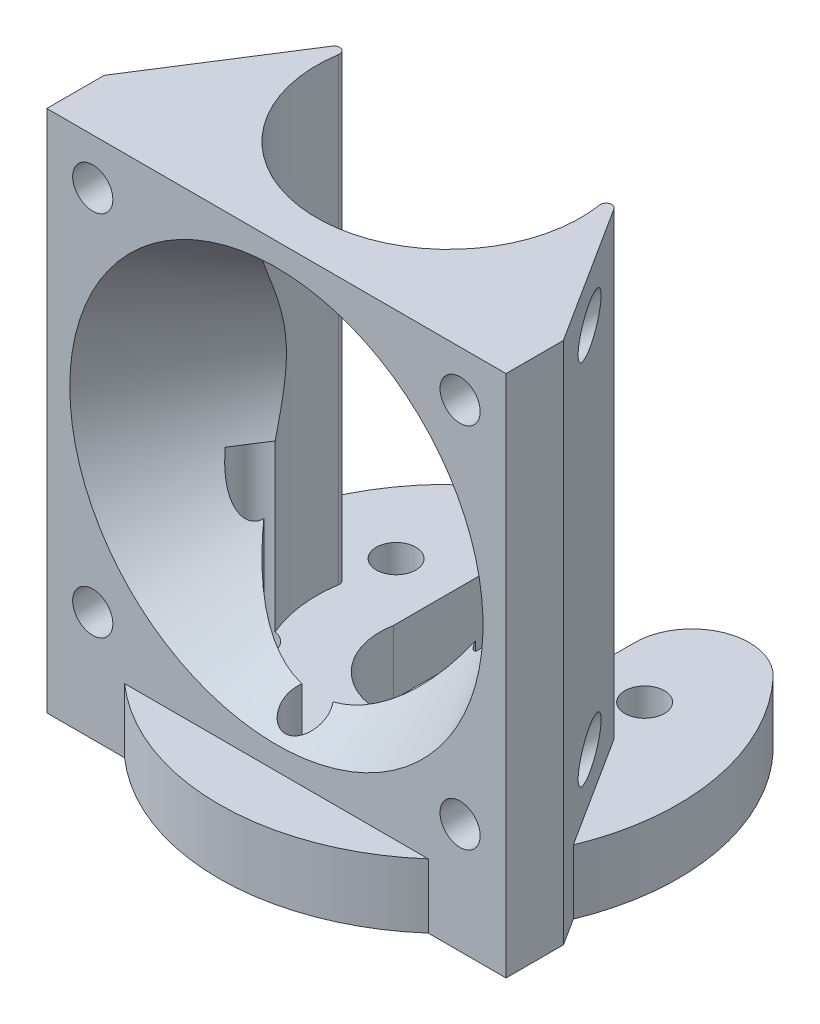
from build123d import *

# Parameters (mm, degrees)
SKETCH1_R           = 20
SKETCH1_R_2         = 6
BOSS_EXTRUDE1_DEPTH = 5.6
CUT_EXTRUDE1_DEPTH  = 29.833314066
FILLET1_R           = 5
BOSS_EXTRUDE2_DEPTH = 40
BOSS_EXTRUDE3_REACH = 55.66
FILLET2_R           = 0.5
SKETCH6_R           = 1.75
CUT_EXTRUDE2_DEPTH  = 59.290171969
SKETCH7_R           = 1.725
CUT_EXTRUDE4_DEPTH  = 20


with BuildPart() as part:
    # Sketch1 → Boss-Extrude1 (new body)
    with BuildSketch(Plane(origin=(0, 0, 0), x_dir=(1, 0, 0), z_dir=(0, 1, 0))):
        Circle(SKETCH1_R)
        Circle(SKETCH1_R_2, mode=Mode.SUBTRACT)
    extrude(amount=BOSS_EXTRUDE1_DEPTH)

    # Sketch2 → Cut-Extrude1 (cut, through all)
    with BuildSketch(Plane(origin=(0, 5.6, 0), x_dir=(1, 0, 0), z_dir=(0, 1, 0))):
        with BuildLine():
            Line((-5.9, 1.090871211), (-5.9, 19.109945055))
            ThreePointArc((-5.9, 19.109945055), (0, 20), (5.9, 19.109945055))
            Line((5.9, 19.109945055), (5.9, 1.090871211))
            ThreePointArc((5.9, 1.090871211), (0, 6), (-5.9, 1.090871211))
        make_face()
    extrude(amount=-CUT_EXTRUDE1_DEPTH, mode=Mode.SUBTRACT)

    # Fillet1
    fillet1_edges = [part.edges().sort_by_distance(p)[0] for p in [
        (5.9, 2.8, -19.109945055),
        (-5.9, 2.8, -19.109945055),
    ]]
    fillet(fillet1_edges, radius=FILLET1_R)

    # Sketch3 → Boss-Extrude2 (add)
    with BuildSketch(Plane(origin=(0, 5.6, 0), x_dir=(1, 0, 0), z_dir=(0, 1, 0))):
        with BuildLine():
            Line((-20, -15), (20, -15))
            Line((20, -15), (20, -10))
            Line((20, -10), (9.700666049, 6.176332099))
            ThreePointArc((9.700666049, 6.176332099), (0, -11.5), (-9.700666049, 6.176332099))
            Line((-9.700666049, 6.176332099), (-20, -10))
            Line((-20, -10), (-20, -15))
        make_face()
    extrude(amount=BOSS_EXTRUDE2_DEPTH)

    # Sketch4 → Boss-Extrude3 (add, up to next)
    with BuildSketch(Plane.XZ, mode=Mode.PRIVATE) as boss_extrude3_sk1:
        with BuildLine():
            Line((13.228756555, 15), (20, 15))
            Line((20, 15), (20, 10))
            Line((20, 10), (18.488817631, 7.626507891))
            ThreePointArc((18.488817631, 7.626507891), (16.281683713, 11.6149376), (13.228756555, 15))
        make_face()
    boss_extrude3_tool1 = extrude(boss_extrude3_sk1.sketch, amount=-BOSS_EXTRUDE3_REACH, mode=Mode.PRIVATE) - part.part
    # Sketch4 → Boss-Extrude3 (add, up to next)
    with BuildSketch(Plane.XZ, mode=Mode.PRIVATE) as boss_extrude3_sk2:
        with BuildLine():
            Line((-20, 10), (-18.488817631, 7.626507891))
            ThreePointArc((-18.488817631, 7.626507891), (-16.281683713, 11.6149376), (-13.228756555, 15))
            Line((-13.228756555, 15), (-20, 15))
            Line((-20, 15), (-20, 10))
        make_face()
    boss_extrude3_tool2 = extrude(boss_extrude3_sk2.sketch, amount=-BOSS_EXTRUDE3_REACH, mode=Mode.PRIVATE) - part.part
    add(boss_extrude3_tool1.solids().sort_by_distance((17.721122, 0, 12.432326))[0])
    add(boss_extrude3_tool2.solids().sort_by_distance((-17.721122, 0, 12.432326))[0])

    # Fillet2
    fillet2_edges = [part.edges().sort_by_distance(p)[0] for p in [
        (-9.700666049, 25.6, -6.176332099),
    ]]
    fillet(fillet2_edges, radius=FILLET2_R)
    fillet2_2_edges = [part.edges().sort_by_distance(p)[0] for p in [
        (9.700666049, 25.6, -6.176332099),
    ]]
    fillet(fillet2_2_edges, radius=FILLET2_R)

    # Sketch5 → Cut-Revolve1 (revolve, cut)
    with BuildSketch(Plane(origin=(0, 25.6, 0), x_dir=(1, 0, 0), z_dir=(0, 1, 0))):
        Polygon((0, -15), (18, -15), (11.092194302, -3.035329563), (0, -3.035329563), align=None)
    revolve(axis=Axis((0, 25.6, 0), (0, 0, 1)), mode=Mode.SUBTRACT)

    # Sketch6 → Cut-Extrude2 (cut, through all)
    with BuildSketch(Plane.XY.offset(15)):
        with Locations((-16, 9.6)):
            Circle(SKETCH6_R)
        with Locations((16, 9.6)):
            Circle(SKETCH6_R)
        with Locations((16, 41.6)):
            Circle(SKETCH6_R)
        with Locations((-16, 41.6)):
            Circle(SKETCH6_R)
    extrude(amount=-CUT_EXTRUDE2_DEPTH, mode=Mode.SUBTRACT)

    # Sketch7 → Cut-Extrude4 (cut)
    with BuildSketch(Plane.XZ):
        with Locations((0, 12.5)):
            Circle(SKETCH7_R)
        with Locations((10.825317547, 6.25)):
            Circle(SKETCH7_R)
        with Locations((10.825317547, -6.25)):
            Circle(SKETCH7_R)
        with Locations((0, -12.5)):
            Circle(SKETCH7_R)
        with Locations((-10.825317547, -6.25)):
            Circle(SKETCH7_R)
        with Locations((-10.825317547, 6.25)):
            Circle(SKETCH7_R)
    extrude(amount=-CUT_EXTRUDE4_DEPTH, mode=Mode.SUBTRACT)


solid = part.part
